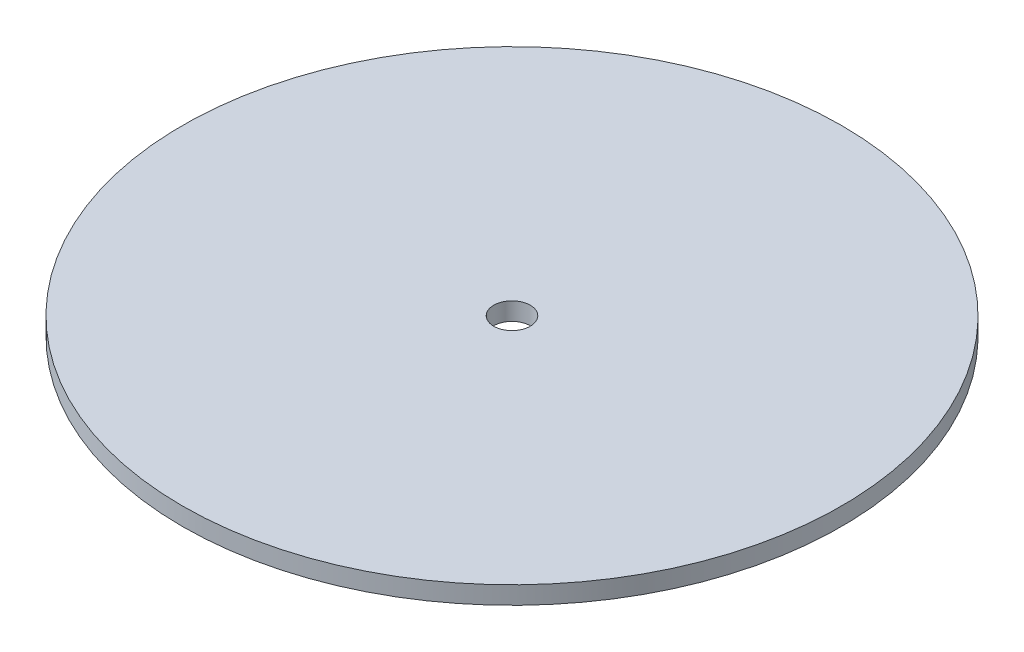
from build123d import *

# Parameters (mm, degrees)
SKETCH1_R           = 74.04
SKETCH1_R_2         = 4.1
BOSS_EXTRUDE1_DEPTH = 4


with BuildPart() as part:
    # Sketch1 → Boss-Extrude1 (new body)
    with BuildSketch(Plane(origin=(0, 0, 0), x_dir=(1, 0, 0), z_dir=(0, 1, 0))):
        Circle(SKETCH1_R)
        Circle(SKETCH1_R_2, mode=Mode.SUBTRACT)
    extrude(amount=BOSS_EXTRUDE1_DEPTH)


solid = part.part
